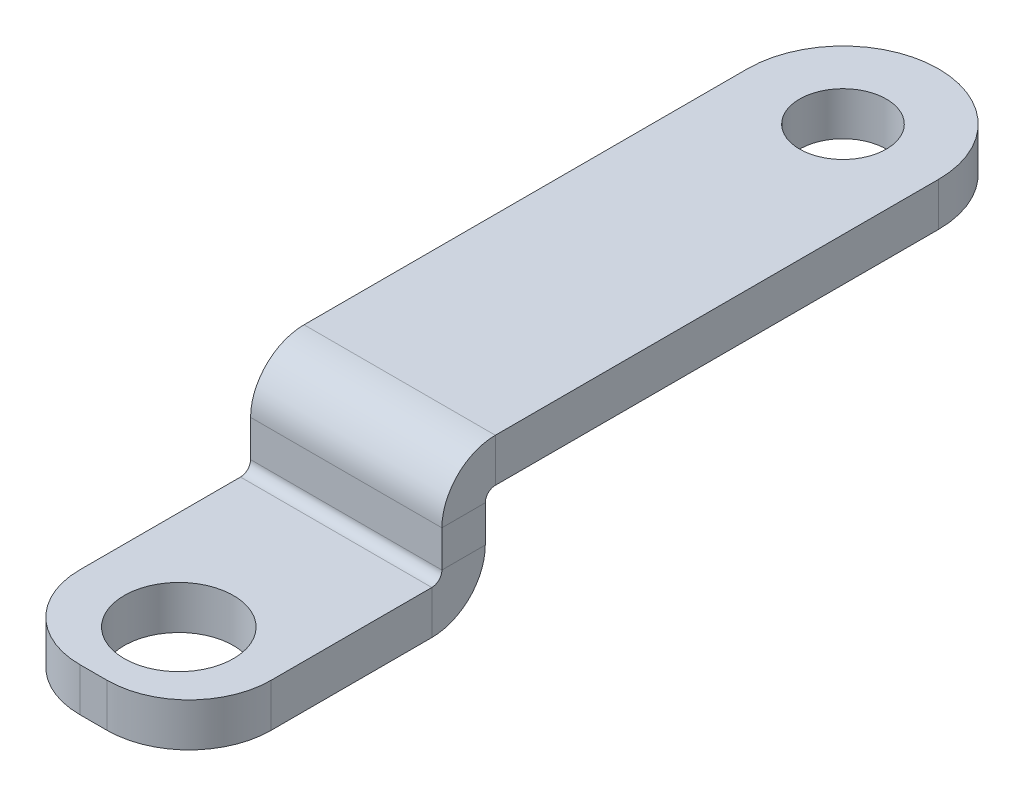
from build123d import *

# Parameters (mm, degrees)
SKETCH1_R                    = 4
BASE_FLANGE1_DEPTH           = 3.175
EDGE_FLANGE1_STRIP_W         = 14.1732
EDGE_FLANGE1_STRIP_H         = 3.175
EDGE_FLANGE1_STRIP_CUT_DEPTH = 14
EDGE_FLANGE1_DEPTH           = 14
EDGE_FLANGE2_STRIP_W         = 14.1732
EDGE_FLANGE2_STRIP_H         = 3.175
EDGE_FLANGE2_STRIP_CUT_DEPTH = 14
EDGE_FLANGE2_DEPTH           = 14
SKETCH17_R                   = 3.175
CUT_EXTRUDE1_DEPTH           = 3.175


# Sheet-metal steps are written as plain solids
with BuildPart() as part:
    # Sketch1 → Base-Flange1 (new body)
    with BuildSketch(Plane(origin=(0, 0, 0), x_dir=(1, 0, 0), z_dir=(0, 1, 0))):
        with BuildLine():
            Line((6.750002463, 0), (6.750002463, 12.5))
            Line((6.750002463, 12.5), (-7.249997537, 12.5))
            Line((-7.249997537, 12.5), (-7.249997537, 0))
            ThreePointArc((-7.249997537, 0), (-5.492638224, -4.242640687), (-1.249997537, -6))
            Line((-1.249997537, -6), (0.750002463, -6))
            ThreePointArc((0.750002463, -6), (4.99264315, -4.242640687), (6.750002463, 0))
        make_face()
        with Locations(Location((0, 0, 0), (0, 0, 270))):
            Circle(SKETCH1_R, mode=Mode.SUBTRACT)
    extrude(amount=-BASE_FLANGE1_DEPTH)

    # Edge-Flange1 strip (across the edge) → Edge-Flange1 strip cut (cut)
    with BuildSketch(Plane(origin=(6.750002463, 0, -12.5), x_dir=(0, 0, 1), z_dir=(-1, 0, 0))):
        with Locations((-6.35, -1.5875)):
            Rectangle(EDGE_FLANGE1_STRIP_W, EDGE_FLANGE1_STRIP_H)
    extrude(amount=EDGE_FLANGE1_STRIP_CUT_DEPTH, mode=Mode.SUBTRACT)

    # Edge-Flange1 section (across the edge) → Edge-Flange1 (add)
    with BuildSketch(Plane(origin=(6.750002463, 0, -12.5), x_dir=(0, 0, 1), z_dir=(-1, 0, 0))):
        with BuildLine():
            Line((-3.175, 0.7366), (-3.175, 7.324994814))
            Line((-3.175, 7.324994814), (0, 7.324994814))
            Line((0, 7.324994814), (0, 0.7366))
            ThreePointArc((0, 0.7366), (0.215745145, 0.215745145), (0.7366, 0))
            Line((0.7366, 0), (0.7366, -3.175))
            ThreePointArc((0.7366, -3.175), (-2.029318885, -2.029318885), (-3.175, 0.7366))
        make_face()
    extrude(amount=EDGE_FLANGE1_DEPTH)

    # Edge-Flange2 strip (across the edge) → Edge-Flange2 strip cut (cut)
    with BuildSketch(Plane(origin=(-7.249997537, 7.324994814, -15.675), x_dir=(0, -1, 0), z_dir=(1, 0, 0))):
        with Locations((-3.175, -1.5875)):
            Rectangle(EDGE_FLANGE2_STRIP_W, EDGE_FLANGE2_STRIP_H)
    extrude(amount=EDGE_FLANGE2_STRIP_CUT_DEPTH, mode=Mode.SUBTRACT)

    # Edge-Flange2 section (across the edge) → Edge-Flange2 (add)
    with BuildSketch(Plane(origin=(-7.249997537, 7.324994814, -15.675), x_dir=(0, -1, 0), z_dir=(1, 0, 0))):
        with BuildLine():
            Line((0, 0.7366), (0, 40.175004419))
            Line((0, 40.175004419), (3.175, 40.175004419))
            Line((3.175, 40.175004419), (3.175, 0.7366))
            ThreePointArc((3.175, 0.7366), (3.390745145, 0.215745145), (3.9116, 0))
            Line((3.9116, 0), (3.9116, -3.175))
            ThreePointArc((3.9116, -3.175), (1.145681115, -2.029318885), (0, 0.7366))
        make_face()
    extrude(amount=EDGE_FLANGE2_DEPTH)

    # Sketch17 → Cut-Extrude1 (cut)
    with BuildSketch(Plane(origin=(0, 7.324994814, 0), x_dir=(1, 0, 0), z_dir=(0, 1, 0))):
        with BuildLine():
            ThreePointArc((-7.249997537, 48.850004419), (-5.199745006, 53.799751887), (-0.249997537, 55.850004419))
            Line((-0.249997537, 55.850004419), (-7.249997537, 55.850004419))
            Line((-7.249997537, 55.850004419), (-7.249997537, 48.850004419))
        make_face()
        with BuildLine():
            ThreePointArc((-0.249997537, 55.850004419), (4.699749931, 53.799751887), (6.750002463, 48.850004419))
            Line((6.750002463, 48.850004419), (6.750002463, 55.850004419))
            Line((6.750002463, 55.850004419), (-0.249997537, 55.850004419))
        make_face()
        with Locations(Location((-0.249997537, 48.850004419, 0), (0, 0, 270))):
            Circle(SKETCH17_R)
    extrude(amount=-CUT_EXTRUDE1_DEPTH, mode=Mode.SUBTRACT)


solid = part.part
